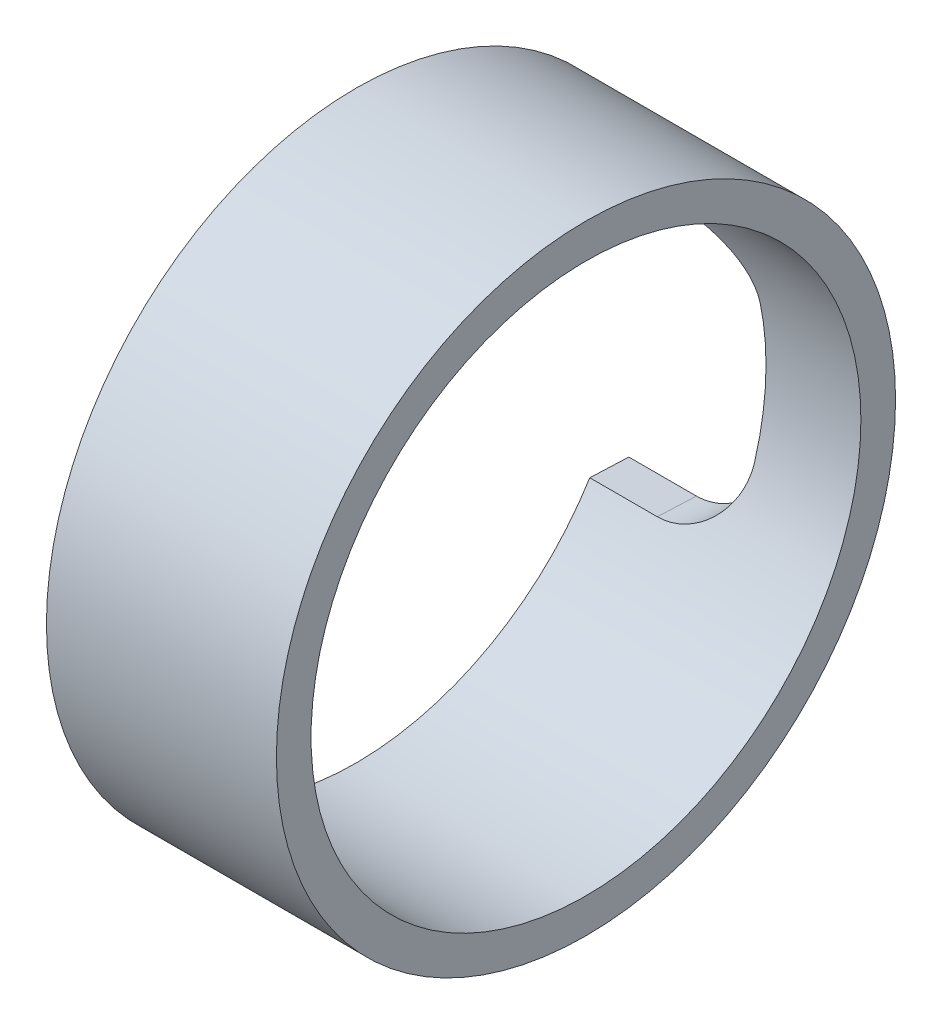
from build123d import *

# Parameters (mm, degrees)
SKETCH1_W          = 6.485999982
SKETCH1_H          = 0.977250014
CUT_EXTRUDE1_REACH = 49.014


with BuildPart() as part:
    # Sketch1 → Revolve1 (revolve)
    with BuildSketch(Plane.XY):
        with Locations((-42.119999961, 8.242624993)):
            Rectangle(SKETCH1_W, SKETCH1_H)
    revolve(axis=Axis((0, 0, 0), (-1, 0, 0)))

    # Sketch3 → Cut-Extrude1 (cut, up to next)
    with BuildSketch(Plane(origin=(0, 0, 0), x_dir=(1, 0, 0), z_dir=(0, -0.04069074645646214, -0.9991717886093543)), mode=Mode.PRIVATE) as cut_extrude1_sk1:
        with BuildLine():
            Line((-45.362999952, 3.81), (-45.362999952, -3.81))
            Line((-45.362999952, -3.81), (-43.457999952, -3.81))
            ThreePointArc((-43.457999952, -3.81), (-42.110961534, -3.252038418), (-41.552999952, -1.905))
            Line((-41.552999952, -1.905), (-41.552999952, 1.905))
            ThreePointArc((-41.552999952, 1.905), (-42.110961534, 3.252038418), (-43.457999952, 3.81))
            Line((-43.457999952, 3.81), (-45.362999952, 3.81))
        make_face()
    cut_extrude1_tool1 = extrude(cut_extrude1_sk1.sketch, amount=CUT_EXTRUDE1_REACH, mode=Mode.PRIVATE) & part.part
    add(cut_extrude1_tool1.solids().sort_by_distance((-43.541875, 0, 0))[0], mode=Mode.SUBTRACT)


solid = part.part
